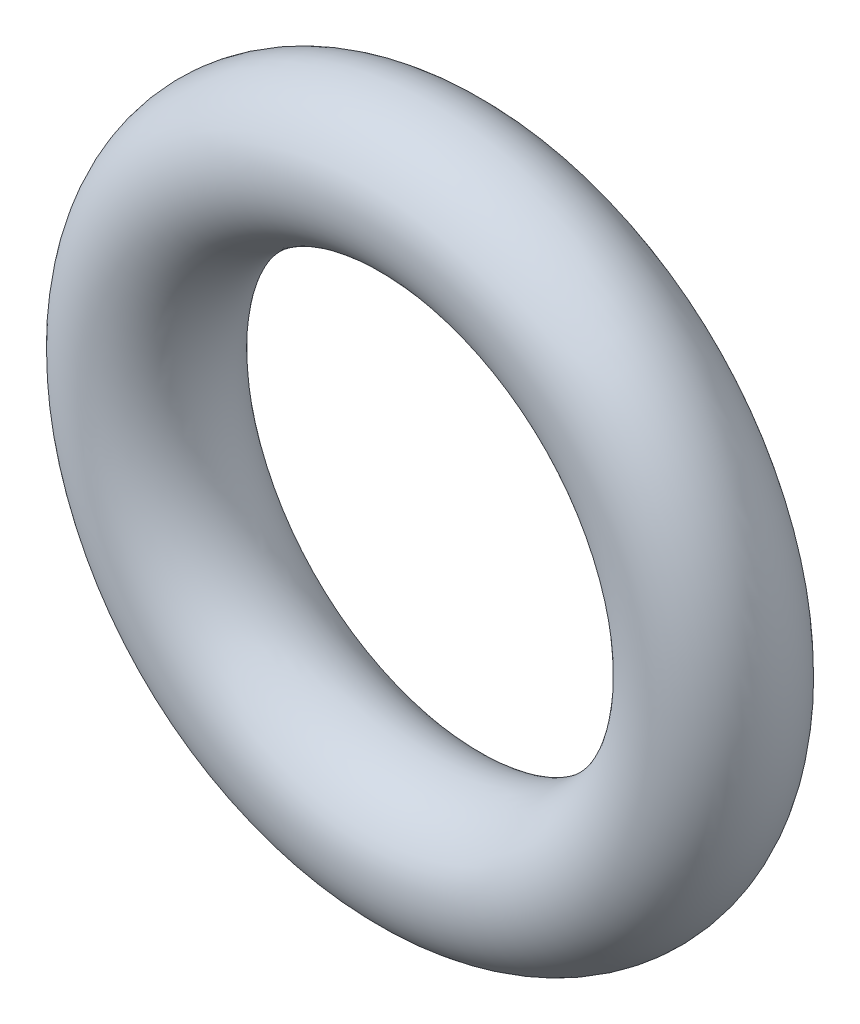
from build123d import *

# Parameters (mm, degrees)
SWEEP1_PROFILE_R = 0.75


with BuildPart() as part:
    # Sweep1: sweep along a path in Sketch1
    with BuildLine(Plane.XY) as sweep1_path:
        CenterArc((0, 0), 3, 0, 360)
    # Sweep1 profile (on start of the path) → Sweep1 (sweep)
    with BuildSketch(Plane(origin=(3, 0, 0), x_dir=(0, 0, 1), z_dir=(0, 1, 0))):
        Circle(SWEEP1_PROFILE_R)
    sweep(path=sweep1_path.line)


solid = part.part
